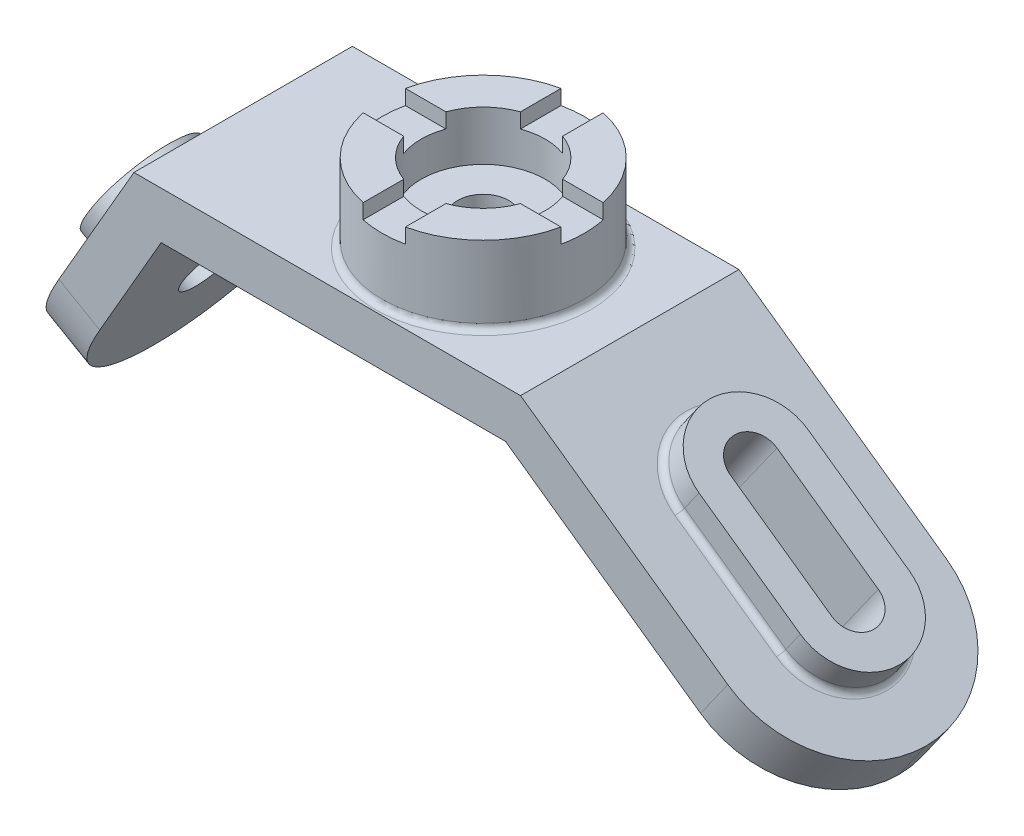
from build123d import *

# Parameters (mm, degrees)
BOSS_EXTRUDE1_DEPTH                                  = 22.352
FILLET1_R                                            = 22.352
CUT_EXTRUDE1_DEPTH                                   = 136.349100872
BOSS_EXTRUDE2_START                                  = 6.35
BOSS_EXTRUDE2_DEPTH                                  = 6.35
SKETCH4_R                                            = 11.176
BOSS_EXTRUDE3_DEPTH                                  = 6.35
F_3_8_0_44_DIAMETER_HOLE1_D                          = 11.176
SKETCH7_R                                            = 20.701
BOSS_EXTRUDE4_DEPTH                                  = 16.002
CUT_EXTRUDE2_START                                   = -3.048
SKETCH8_W                                            = 8.636
SKETCH8_H                                            = 8.636
CUT_EXTRUDE2_DEPTH                                   = 3.048
CBORE_FOR_3_8_BINDING_HEAD_MACHINE_SCREW_D           = 10.414
CBORE_FOR_3_8_BINDING_HEAD_MACHINE_SCREW_CBORE_D     = 25.4
CBORE_FOR_3_8_BINDING_HEAD_MACHINE_SCREW_CBORE_DEPTH = 10.16
FILLET2_R                                            = 1.27


with BuildPart() as part:
    # Sketch1 → Boss-Extrude1 (new, symmetric)
    with BuildSketch(Plane.XY):
        Polygon((-23.756808877, -41.148), (0, 0), (70.477191123, 0), (128.643191123, -41.148), (134.217439977, -33.268351929), (73.546078299, 9.652), (-5.572584798, 9.652), (-32.115686074, -36.322), align=None)
    extrude(amount=BOSS_EXTRUDE1_DEPTH, both=True)

    # Fillet1
    fillet1_edges = [part.edges().sort_by_distance(p)[0] for p in [
        (-27.936247475, -38.735, 22.352),
        (-27.936247475, -38.735, -22.352),
        (131.43031555, -37.208175965, -22.352),
        (131.43031555, -37.208175965, 22.352),
    ]]
    fillet(fillet1_edges, radius=FILLET1_R - 0.0001)  # a hair under: the kernel refuses the full size

    # Sketch2 → Cut-Extrude1 (cut, through all)
    with BuildSketch(Plane(origin=(29.080678336, 41.107872463, 0), x_dir=(0.8163746447104718, -0.5775226744240014, 0), z_dir=(0.5775226744240014, 0.8163746447104718, 0))):
        with BuildLine():
            Line((106.432942455, -4.7752), (81.032942455, -4.7752))
            ThreePointArc((81.032942455, -4.7752), (76.257742455, 0), (81.032942455, 4.7752))
            Line((81.032942455, 4.7752), (106.432942455, 4.7752))
            ThreePointArc((106.432942455, 4.7752), (111.208142455, 0), (106.432942455, -4.7752))
        make_face()
    extrude(amount=-CUT_EXTRUDE1_DEPTH, mode=Mode.SUBTRACT)

    # Sketch3 → Boss-Extrude2 (add)
    with BuildSketch(Plane(origin=(29.080678336, 41.107872463, 0), x_dir=(0.8163746447104718, -0.5775226744240014, 0), z_dir=(0.5775226744240014, 0.8163746447104718, 0)).offset(BOSS_EXTRUDE2_START)):
        with BuildLine():
            Line((81.032942455, 11.176), (106.432942455, 11.176))
            ThreePointArc((106.432942455, 11.176), (117.608942455, 0), (106.432942455, -11.176))
            Line((106.432942455, -11.176), (81.032942455, -11.176))
            ThreePointArc((81.032942455, -11.176), (69.856942455, 0), (81.032942455, 11.176))
        make_face()
        with BuildLine():
            Line((81.032942455, 4.7752), (106.432942455, 4.7752))
            ThreePointArc((106.432942455, 4.7752), (111.208142455, 0), (106.432942455, -4.7752))
            Line((106.432942455, -4.7752), (81.032942455, -4.7752))
            ThreePointArc((81.032942455, -4.7752), (76.257742455, 0), (81.032942455, 4.7752))
        make_face(mode=Mode.SUBTRACT)
    extrude(amount=-BOSS_EXTRUDE2_DEPTH)

    # Sketch4 → Boss-Extrude3 (add)
    with BuildSketch(Plane(origin=(-8.358877197, 4.826, 0), x_dir=(0, 0, 1), z_dir=(-0.8660254037844402, 0.4999999999999977, 0))):
        with Locations(Location((0, -25.161617753, 0), (0, 0, 90))):
            Circle(SKETCH4_R)
    extrude(amount=BOSS_EXTRUDE3_DEPTH)

    # 3/8 (0.44) Diameter Hole1 (through all)
    with Locations(Plane(origin=(-13.858138511, 8.001, 0), x_dir=(0, 0, 1), z_dir=(-0.86602540378444, 0.49999999999999784, 0))):
        with Locations((0, -25.161617753)):
            Hole(F_3_8_0_44_DIAMETER_HOLE1_D / 2)

    # Sketch7 → Boss-Extrude4 (add)
    with BuildSketch(Plane(origin=(0, 9.652, 0), x_dir=(1, 0, 0), z_dir=(0, 1, 0))):
        with Locations(Location((43.551015202, 0, 0), (0, 0, 180))):
            Circle(SKETCH7_R)
    extrude(amount=BOSS_EXTRUDE4_DEPTH)

    # Sketch8 → Cut-Extrude2 (cut)
    with BuildSketch(Plane(origin=(0, 25.654, 0), x_dir=(1, 0, 0), z_dir=(0, 1, 0)).offset(CUT_EXTRUDE2_START)):
        with BuildLine():
            Line((39.233015202, 20.245648347), (39.233015202, 4.318))
            Line((39.233015202, 4.318), (47.869015202, 4.318))
            Line((47.869015202, 4.318), (47.869015202, 20.245648347))
            ThreePointArc((47.869015202, 20.245648347), (43.551015202, 20.701), (39.233015202, 20.245648347))
        make_face()
        with Locations((43.551015202, 0)):
            Rectangle(SKETCH8_W, SKETCH8_H)
        with BuildLine():
            Line((63.796663549, 4.318), (47.869015202, 4.318))
            Line((47.869015202, 4.318), (47.869015202, -4.318))
            Line((47.869015202, -4.318), (63.796663549, -4.318))
            ThreePointArc((63.796663549, -4.318), (64.137862549, -2.170971506), (64.252015202, 0))
            ThreePointArc((64.252015202, 0), (64.137862549, 2.170971506), (63.796663549, 4.318))
        make_face()
        with BuildLine():
            Line((47.869015202, -4.318), (39.233015202, -4.318))
            Line((39.233015202, -4.318), (39.233015202, -20.245648347))
            ThreePointArc((39.233015202, -20.245648347), (43.551015202, -20.701), (47.869015202, -20.245648347))
            Line((47.869015202, -20.245648347), (47.869015202, -4.318))
        make_face()
        with BuildLine():
            Line((39.233015202, 4.318), (23.305366855, 4.318))
            ThreePointArc((23.305366855, 4.318), (22.850015202, 0), (23.305366855, -4.318))
            Line((23.305366855, -4.318), (39.233015202, -4.318))
            Line((39.233015202, -4.318), (39.233015202, 4.318))
        make_face()
    extrude(amount=CUT_EXTRUDE2_DEPTH, mode=Mode.SUBTRACT)

    # CBORE for 3/8 Binding Head Machine Screw1 (through all)
    with Locations(Plane(origin=(0, 25.654, 0), x_dir=(1, 0, 0), z_dir=(0, 1, 0))):
        with Locations((43.551015202, 0)):
            CounterBoreHole(CBORE_FOR_3_8_BINDING_HEAD_MACHINE_SCREW_D / 2, CBORE_FOR_3_8_BINDING_HEAD_MACHINE_SCREW_CBORE_D / 2, CBORE_FOR_3_8_BINDING_HEAD_MACHINE_SCREW_CBORE_DEPTH)

    # Fillet2
    fillet2_edges = [part.edges().sort_by_distance(p)[0] for p in [
        (86.110114913, 0.763904229, 0),
        (105.601875931, -13.025027145, 11.176),
        (125.093636948, -26.81395852, 0),
        (105.601875931, -13.025027145, -11.176),
        (-26.527686074, -26.643300087, 0),
        (64.252015202, 9.652, 0),
    ]]
    fillet(fillet2_edges, radius=FILLET2_R)


solid = part.part
